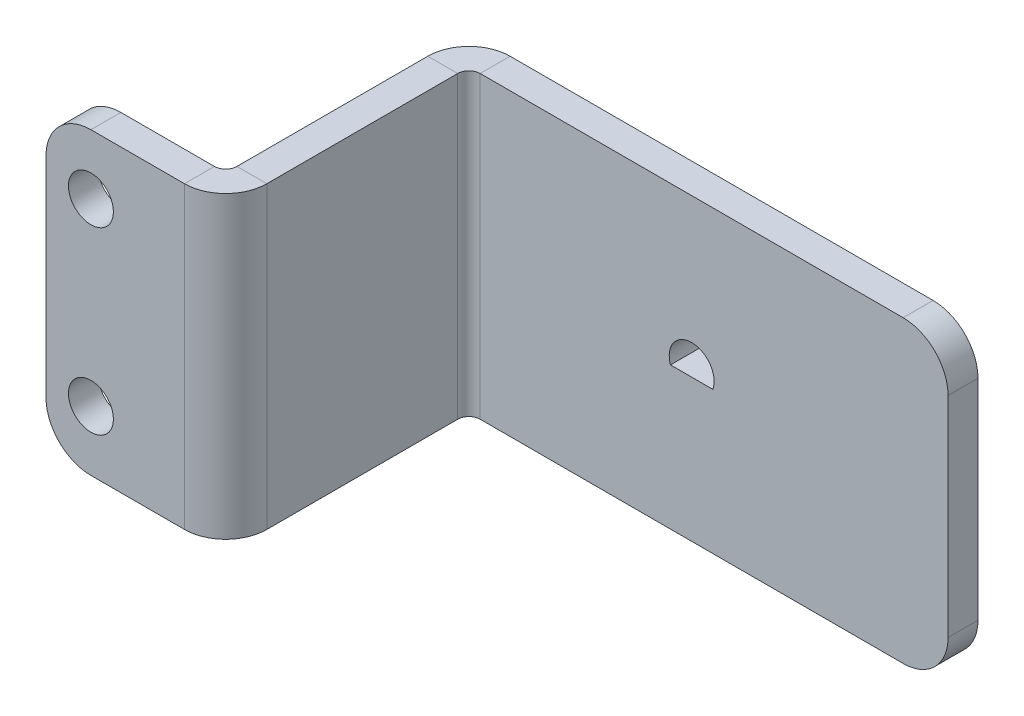
from build123d import *

# Parameters (mm, degrees)
BASE_FLANGE1_DEPTH    = 10
FILLET1_R             = 3
SKETCH7_R             = 1.5
CUT_EXTRUDE1_DEPTH    = 39.171488051
BODY_MOVE_COPY1_ANGLE = 90


# Sheet-metal steps are written as plain solids
with BuildPart() as part:
    # Sketch1 → Base-Flange1 (new, symmetric)
    with BuildSketch(Plane.XY):
        with BuildLine():
            Line((-12, 0), (-2.75, 0))
            ThreePointArc((-2.75, 0), (-0.805456352, 0.805456352), (0, 2.75))
            Line((0, 2.75), (0, 15.5))
            ThreePointArc((0, 15.5), (0.219669914, 16.030330086), (0.75, 16.25))
            Line((0.75, 16.25), (32, 16.25))
            Line((32, 16.25), (32, 18.25))
            Line((32, 18.25), (0.75, 18.25))
            ThreePointArc((0.75, 18.25), (-1.194543648, 17.444543648), (-2, 15.5))
            Line((-2, 15.5), (-2, 2.75))
            ThreePointArc((-2, 2.75), (-2.219669914, 2.219669914), (-2.75, 2))
            Line((-2.75, 2), (-12, 2))
            Line((-12, 2), (-12, 0))
        make_face()
    extrude(amount=BASE_FLANGE1_DEPTH, both=True)

    # Fillet1
    fillet1_edges = [part.edges().sort_by_distance(p)[0] for p in [
        (32, 17.25, -10),
        (-12, 1, -10),
        (32, 17.25, 10),
        (-12, 1, 10),
    ]]
    fillet(fillet1_edges, radius=FILLET1_R)

    # Sketch7 → Cut-Extrude1 (cut, through all)
    with BuildSketch(Plane(origin=(0, 0, 0), x_dir=(1, 0, 0), z_dir=(0, 1, 0))):
        with BuildLine():
            Line((16.289213562, 0.5), (13.460786438, 0.5))
            ThreePointArc((13.460786438, 0.5), (14.621347032, -1.478397839), (16.375, 0))
            ThreePointArc((16.375, 0), (16.353397839, 0.253652968), (16.289213562, 0.5))
        make_face()
        with Locations((-9, -6)):
            Circle(SKETCH7_R)
        with Locations((-9, 6)):
            Circle(SKETCH7_R)
    extrude(amount=CUT_EXTRUDE1_DEPTH, mode=Mode.SUBTRACT)


with BuildPart() as part_1:
    # Body-Move/Copy1: moved
    add(part.part.rotate(Axis((0, 7.6, 0), (-1, 0, 0)), BODY_MOVE_COPY1_ANGLE))


solid = part_1.part
